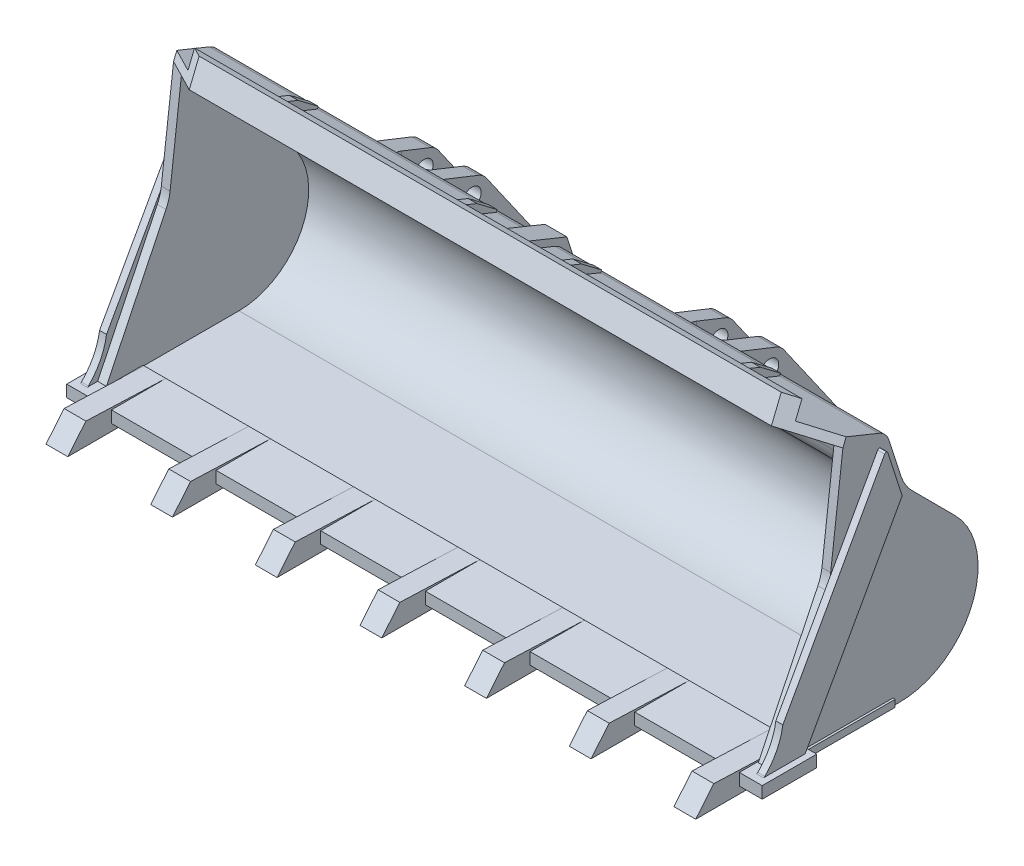
from build123d import *
from OCP.BRepFilletAPI import BRepFilletAPI_MakeChamfer

# Parameters (mm, degrees)
BOSS_EXTRUDE1_DEPTH            = 38.375
FILLET1_R                      = 5
FILLET2_R                      = 2
FILLET3_R                      = 5
SHELL1_DEPTH                   = 37.375
SKETCH3_W                      = 6.25
SKETCH3_H                      = 1.35
BOSS_EXTRUDE2_DEPTH            = 39.875
SKETCH4_W                      = 10.25
SKETCH4_H                      = 0.8
BOSS_EXTRUDE3_DEPTH            = 38.625
BOSS_EXTRUDE4_DEPTH            = 0.8
FILLET4_R                      = 0.2
CUT_EXTRUDE1_REACH             = 52.96
CUT_EXTRUDE1_DIRECTION_2_DEPTH = 51.959549416
BOSS_EXTRUDE5_START            = 1.25
BOSS_EXTRUDE5_DEPTH            = 1.25
SKETCH8_W                      = 1
SKETCH8_H                      = 6.496982244
BOSS_EXTRUDE6_DEPTH            = 1
CHAMFER1_SIZE                  = 0.75
CHAMFER1_SIZE2                 = 2.799038106
BOSS_EXTRUDE7_DEPTH            = 20.875
CUT_EXTRUDE2_DEPTH             = 60.107566622
CUT_EXTRUDE2_DEPTH_BACK        = 41.75
SKETCH10_W                     = 26.5
SKETCH10_H                     = 39.60831662
CUT_EXTRUDE3_DEPTH             = 60.107566622
CUT_EXTRUDE3_DEPTH_BACK        = 60.107566622
SKETCH11_R                     = 1.05
BOSS_EXTRUDE8_DEPTH            = 1.25
LPATTERN2_COUNT                = 4
LPATTERN2_PITCH                = 12
LPATTERN2_COL_COUNT            = 4
LPATTERN2_COL_PITCH            = 12


# Read off the part's stored shape, not the designer's step: Shell1
with BuildPart() as part:
    # Sketch1 → Boss-Extrude1 (new body)
    with BuildSketch(Plane(origin=(0, 0, 0), x_dir=(0, 0, -1), z_dir=(1, 0, 0))):
        with BuildLine():
            Line((0, 0), (0, 1))
            Line((0, 1), (7.25, 16))
            Line((7.25, 16), (8.75, 28.5))
            Line((8.75, 28.5), (5.553252135, 29.797421707))
            Line((5.553252135, 29.797421707), (6.681444923, 32.577202459))
            Line((6.681444923, 32.577202459), (7.608038507, 32.201138196))
            Line((7.608038507, 32.201138196), (6.855909982, 30.347951028))
            Line((6.855909982, 30.347951028), (13.740127414, 27.553944899))
            Line((13.740127414, 27.553944899), (15.792332521, 21.203944899))
            Line((15.792332521, 21.203944899), (21.623961423, 15.353944899))
            ThreePointArc((21.623961423, 15.353944899), (23.562205005, 5.549311959), (15.25, 0))
            Line((15.25, 0), (0, 0))
        make_face()
    extrude(amount=BOSS_EXTRUDE1_DEPTH)

    # Fillet1
    fillet1_edges = [part.edges().sort_by_distance(p)[0] for p in [
        (19.1875, 21.203944899, -15.792332521),
    ]]
    fillet(fillet1_edges, radius=FILLET1_R)

    # Fillet2
    fillet2_edges = [part.edges().sort_by_distance(p)[0] for p in [
        (19.1875, 27.553944899, -13.740127414),
    ]]
    fillet(fillet2_edges, radius=FILLET2_R)

    # Fillet3
    fillet3_edges = [part.edges().sort_by_distance(p)[0] for p in [
        (19.1875, 16, -7.25),
    ]]
    fillet(fillet3_edges, radius=FILLET3_R)

    # Shell1 outline → Shell1 (cut)
    with BuildSketch(Plane.YZ):
        with BuildLine():
            ThreePointArc((26.359001958, -13.075384834), (26.732328377, -12.856268859), (26.978074606, -12.499907783))
            Line((26.978074606, -12.499907783), (28.5, -8.75))
            Line((28.5, -8.75), (16.828671243, -7.349440549))
            ThreePointArc((16.828671243, -7.349440549), (16.019438965, -7.183607383), (15.248554043, -6.886801121))
            Line((15.248554043, -6.886801121), (1, 0))
            Line((1, 0), (1, -15.25))
            ThreePointArc((1, -15.25), (5.932721741, -22.638626671), (14.647951021, -20.915743487))
            Line((14.647951021, -20.915743487), (19.647810605, -15.931585255))
            ThreePointArc((19.647810605, -15.931585255), (20.75683177, -15.060127977), (22.038648253, -14.471644982))
            Line((22.038648253, -14.471644982), (26.359001958, -13.075384834))
        make_face()
    extrude(amount=SHELL1_DEPTH, mode=Mode.SUBTRACT)

    # Sketch3 → Boss-Extrude2 (add)
    with BuildSketch(Plane(origin=(0, 0, 0), x_dir=(0, 0, -1), z_dir=(1, 0, 0))):
        with Locations((1.125, 0.425)):
            Rectangle(SKETCH3_W, SKETCH3_H)
    extrude(amount=BOSS_EXTRUDE2_DEPTH)

    # Sketch4 → Boss-Extrude3 (add)
    with BuildSketch(Plane(origin=(0, 0, 0), x_dir=(0, 0, -1), z_dir=(1, 0, 0))):
        with Locations((9.375, 0.4)):
            Rectangle(SKETCH4_W, SKETCH4_H)
    extrude(amount=BOSS_EXTRUDE3_DEPTH)

    # Sketch5 → Boss-Extrude4 (add)
    with BuildSketch(Plane(origin=(38.375, 0, 0), x_dir=(0, 0, -1), z_dir=(1, 0, 0))):
        with BuildLine():
            Line((-1.4, 0.8), (3.459254788, 0.8))
            Line((3.459254788, 0.8), (14.751696416, 21.17210397))
            Line((14.751696416, 21.17210397), (12.962021875, 26.709773325))
            Line((12.962021875, 26.709773325), (1.066675279, 5.25))
            ThreePointArc((1.066675279, 5.25), (0.233575409, 2.803144582), (-1.4, 0.8))
        make_face()
    extrude(amount=BOSS_EXTRUDE4_DEPTH)

    # Fillet4
    fillet4_edges = [part.edges().sort_by_distance(p)[0] for p in [
        (38.775, 1.1, 1.070915731),
        (38.775, 21.17210397, -14.751696416),
        (38.775, 26.709773325, -12.962021875),
    ]]
    fillet(fillet4_edges, radius=FILLET4_R)

    # Sketch6 → Cut-Extrude1 (cut, up to next)
    with BuildSketch(Plane(origin=(0, 28.445014101, -11.544601043), x_dir=(1, 0, 0), z_dir=(0, 0.9265935841802965, -0.3760642628008038)), mode=Mode.PRIVATE) as cut_extrude1_sk1:
        Polygon((38.375, -2.610137628), (33.375, -6.060137628), (38.375, -6.060137628), align=None)
    cut_extrude1_tool1 = extrude(cut_extrude1_sk1.sketch, amount=-CUT_EXTRUDE1_REACH, mode=Mode.PRIVATE) & part.part
    add(cut_extrude1_tool1.solids().sort_by_distance((36.708333, 30.291541, -6.994899))[0], mode=Mode.SUBTRACT)

    # Sketch6 → Cut-Extrude1 direction 2 (cut)
    with BuildSketch(Plane(origin=(0, 28.445014101, -11.544601043), x_dir=(1, 0, 0), z_dir=(0, 0.9265935841802965, -0.3760642628008038))):
        Polygon((38.375, -2.610137628), (33.375, -6.060137628), (38.375, -6.060137628), align=None)
    extrude(amount=CUT_EXTRUDE1_DIRECTION_2_DEPTH, mode=Mode.SUBTRACT)

    # Sketch7 → Boss-Extrude5 (add)
    with BuildSketch(Plane(origin=(0, 0, 0), x_dir=(0, 0, -1), z_dir=(1, 0, 0)).offset(BOSS_EXTRUDE5_START)):
        with BuildLine():
            Line((9.169597709, 29.408925241), (9.451645906, 30.103870429))
            Line((9.451645906, 30.103870429), (14.225275672, 28.166460555))
            Line((14.225275672, 28.166460555), (15.567990813, 24.011787559))
            Line((15.567990813, 24.011787559), (14.949488958, 23.81189895))
            Line((14.949488958, 23.81189895), (14.026926149, 26.666522894))
            ThreePointArc((14.026926149, 26.666522894), (13.588694199, 27.413175733), (12.875972045, 27.90466819))
            Line((12.875972045, 27.90466819), (9.169597709, 29.408925241))
        make_face()
    extrude(amount=-BOSS_EXTRUDE5_DEPTH)

    # Sketch8 → Boss-Extrude6 (add)
    with BuildSketch(Plane(origin=(0, 28.445014101, -11.544601043), x_dir=(1, 0, 0), z_dir=(0, 0.9265935841802965, -0.3760642628008038))):
        with Locations((6, -1.811646506)):
            Rectangle(SKETCH8_W, SKETCH8_H)
        with Locations((26.5, -1.811646506)):
            Rectangle(SKETCH8_W, SKETCH8_H)
    extrude(amount=BOSS_EXTRUDE6_DEPTH)

    # Chamfer1: one chamfer whose edges measure the first distance from different faces: ONE call of the kernel's chamfer builder (chamfer() names one face for all edges)
    chamfer1_edges_1 = [part.edges().sort_by_distance(p)[0] for p in [
        (6, 28.831261774, -13.252036308),
    ]]
    chamfer1_side_1 = [part.faces().sort_by_distance(p)[0] for p in [
        (6, 28.367964982, -13.064004177),
    ]]
    chamfer1_edges_2 = [part.edges().sort_by_distance(p)[0] for p in [
        (26.5, 28.831261774, -13.252036308),
    ]]
    chamfer1_side_2 = [part.faces().sort_by_distance(p)[0] for p in [
        (26.5, 28.367964982, -13.064004177),
    ]]
    chamfer1 = BRepFilletAPI_MakeChamfer(part.part.solid().wrapped)
    for e in chamfer1_edges_1:
        chamfer1.Add(CHAMFER1_SIZE, CHAMFER1_SIZE2, e.wrapped, chamfer1_side_1[0].wrapped)  # the first distance lies on this face
    for e in chamfer1_edges_2:
        chamfer1.Add(CHAMFER1_SIZE, CHAMFER1_SIZE2, e.wrapped, chamfer1_side_2[0].wrapped)  # the first distance lies on this face
    add(Compound.cast(chamfer1.Shape()), mode=Mode.REPLACE)

    # Mirror1: part across plane


with BuildPart() as part_1:
    add(part.part)
    add(part.part.mirror(Plane(origin=(0, 0, 0), x_dir=(0, 0, 1), z_dir=(1, 0, 0))))


with BuildPart() as body_2:
    # Sketch9 → Boss-Extrude7 (new, symmetric)
    with BuildSketch(Plane(origin=(0, 0, 0), x_dir=(0, 0, -1), z_dir=(1, 0, 0))):
        with BuildLine():
            Line((4.25, -0.125), (4.25, 0))
            Line((4.25, 0), (14.5, 0))
            Line((14.5, 0), (15.25, 0))
            ThreePointArc((15.25, 0), (23.562205005, 5.549311959), (21.623961423, 15.353944899))
            Line((21.623961423, 15.353944899), (16.639803191, 20.353804483))
            ThreePointArc((16.639803191, 20.353804483), (15.913588793, 21.277988786), (15.423186297, 22.346169189))
            Line((15.423186297, 22.346169189), (14.026926149, 26.666522894))
            Line((14.026926149, 26.666522894), (18.580721621, 24.858381483))
            ThreePointArc((18.580721621, 24.858381483), (19.083987505, 24.567696843), (19.482430456, 24.144592454))
            Line((19.482430456, 24.144592454), (26.755016011, 13.729731932))
            ThreePointArc((26.755016011, 13.729731932), (27.308796831, 12.696726621), (27.606878217, 11.563183214))
            Line((27.606878217, 11.563183214), (29.009775042, 1.583816325))
            ThreePointArc((29.009775042, 1.583816325), (28.656464048, 0.390933053), (27.524380905, -0.125))
            Line((27.524380905, -0.125), (4.25, -0.125))
        make_face()
    extrude(amount=BOSS_EXTRUDE7_DEPTH, both=True)

    # Sketch10 → Cut-Extrude2 (cut, two sides: drawn at the far end of the back side and taken through both)
    with BuildSketch(Plane(origin=(0, 0, 0), x_dir=(1, 0, 0), z_dir=(0, 1, 0)).offset(-CUT_EXTRUDE2_DEPTH_BACK)):
        with BuildLine():
            Line((-15.05, 39.234380905), (-18.75, 39.234380905))
            Line((-18.75, 39.234380905), (-18.75, 15.275384834))
            ThreePointArc((-18.75, 15.275384834), (-16.9, 13.425384834), (-15.05, 15.275384834))
            Line((-15.05, 15.275384834), (-15.05, 39.234380905))
        make_face()
        with Locations((0, 19.430222595)):
            Rectangle(SKETCH10_W, SKETCH10_H)
        with BuildLine():
            Line((15.05, 15.275384834), (15.05, 39.234380905))
            Line((15.05, 39.234380905), (18.75, 39.234380905))
            Line((18.75, 39.234380905), (18.75, 15.275384834))
            ThreePointArc((18.75, 15.275384834), (16.9, 13.425384834), (15.05, 15.275384834))
        make_face()
    extrude(amount=CUT_EXTRUDE2_DEPTH + CUT_EXTRUDE2_DEPTH_BACK, mode=Mode.SUBTRACT)


with BuildPart() as cut_extrude2_piece_1:
    # of the separate pieces the step leaves, piece 1, a body of its own (cut_extrude2_pieces)
    add(body_2.part.solids().sort_by_distance((-20.875, -0.125, -27.524380905))[0])


with BuildPart() as cut_extrude2_piece_2:
    # of the separate pieces the step leaves, piece 2, a body of its own (cut_extrude2_pieces)
    add(body_2.part.solids().sort_by_distance((13.25, -0.125, -4.25))[0])


with BuildPart() as cut_extrude3_tool:
    # Sketch11 → Cut-Extrude3 (new, two sides: drawn at the far end of the back side and taken through both)
    with BuildSketch(Plane(origin=(0, 0, 0), x_dir=(0, 0, -1), z_dir=(1, 0, 0)).offset(-CUT_EXTRUDE3_DEPTH_BACK)):
        with Locations((27.524380905, 1.375)):
            Circle(SKETCH11_R)
        with Locations((17.842649823, 22.9995512)):
            Circle(SKETCH11_R)
    extrude(amount=CUT_EXTRUDE3_DEPTH + CUT_EXTRUDE3_DEPTH_BACK)


with BuildPart() as cut_extrude2_piece_1_1:
    add(cut_extrude2_piece_1.part)

    # Cut-Extrude3: cut by cut_extrude3_tool
    add(cut_extrude3_tool.part, mode=Mode.SUBTRACT)


with BuildPart() as cut_extrude2_piece_2_1:
    add(cut_extrude2_piece_2.part)

    # Cut-Extrude3: cut by cut_extrude3_tool
    add(cut_extrude3_tool.part, mode=Mode.SUBTRACT)


with BuildPart() as part_2:
    add(part_1.part)

    # Combine1: union Cut-Extrude2 piece 2, Cut-Extrude2 piece 1
    add(cut_extrude2_piece_2_1.part)
    add(cut_extrude2_piece_1_1.part)

    # Sketch12 → Boss-Extrude8 (add, symmetric)
    with BuildSketch(Plane(origin=(0, 0, 0), x_dir=(0, 0, -1), z_dir=(1, 0, 0))):
        Polygon((4.25, 1.1), (3.75, -0.25), (3.75, -1.05), (-7, -1.05), (-4.923344034, 1.45), align=None)
    boss_extrude8 = extrude(amount=BOSS_EXTRUDE8_DEPTH, both=True)

    # LPattern2: Boss-Extrude8 ×4
    with Locations(*[(i * LPATTERN2_PITCH, 0, 0) for i in range(1, LPATTERN2_COUNT)]):
        add(boss_extrude8)

    # LPattern2 col: Boss-Extrude8 ×4
    with Locations(*[(-i * LPATTERN2_COL_PITCH, 0, 0) for i in range(1, LPATTERN2_COL_COUNT)]):
        add(boss_extrude8)


solid = part_2.part
